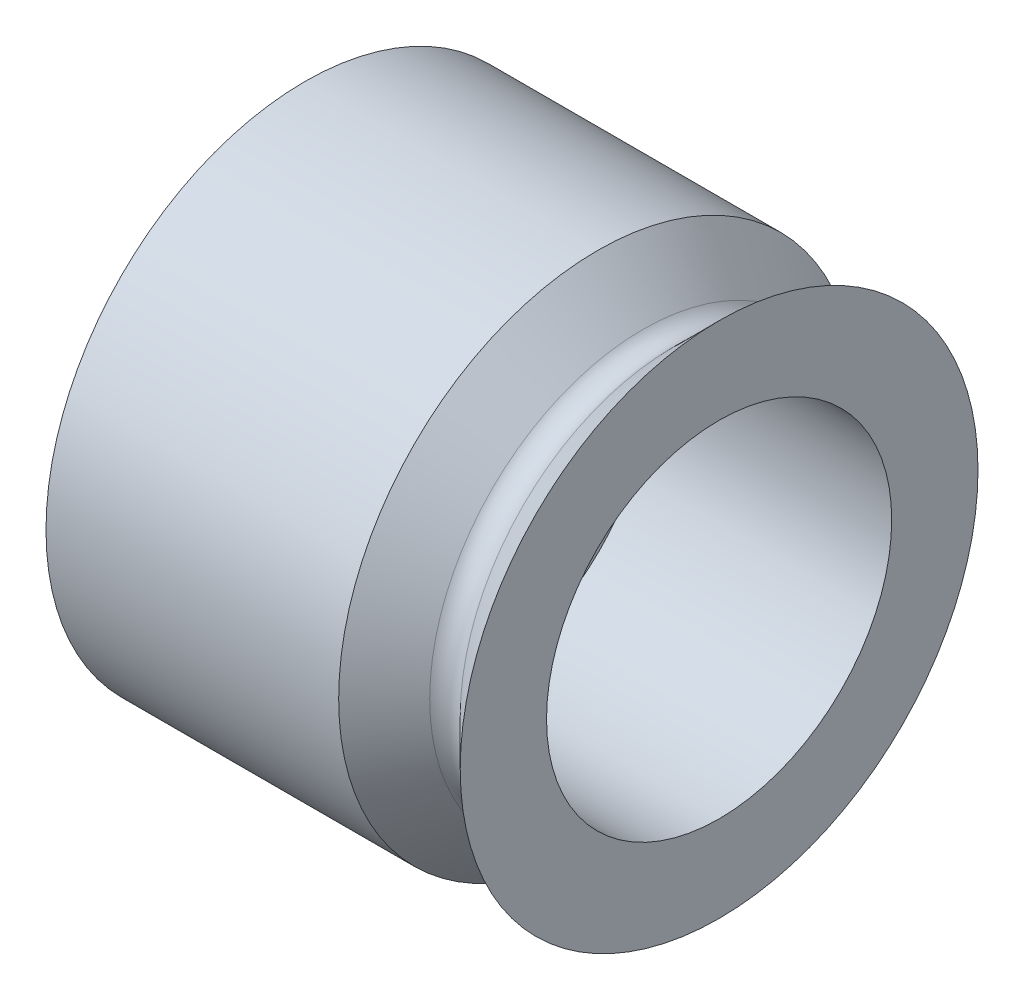
from build123d import *


with BuildPart() as part:
    # Sketch1 → Revolve1 (revolve)
    with BuildSketch(Plane(origin=(0, 0, 0), x_dir=(1, 0, 0), z_dir=(0, 1, 0))):
        with BuildLine():
            Line((0, 2.6), (6.35, 2.6))
            Line((6.35, 2.6), (6.35, 6.35))
            Line((6.35, 6.35), (15.24, 6.35))
            Line((15.24, 6.35), (15.24, 9.525))
            Line((15.24, 9.525), (13.565, 7.85))
            ThreePointArc((13.565, 7.85), (13.003733992, 7.617516008), (12.442467985, 7.85))
            Line((12.442467985, 7.85), (10.767467985, 9.525))
            Line((10.767467985, 9.525), (0, 9.525))
            Line((0, 9.525), (0, 2.6))
        make_face()
    revolve(axis=Axis((0, 0, 0), (1, 0, 0)))


solid = part.part
